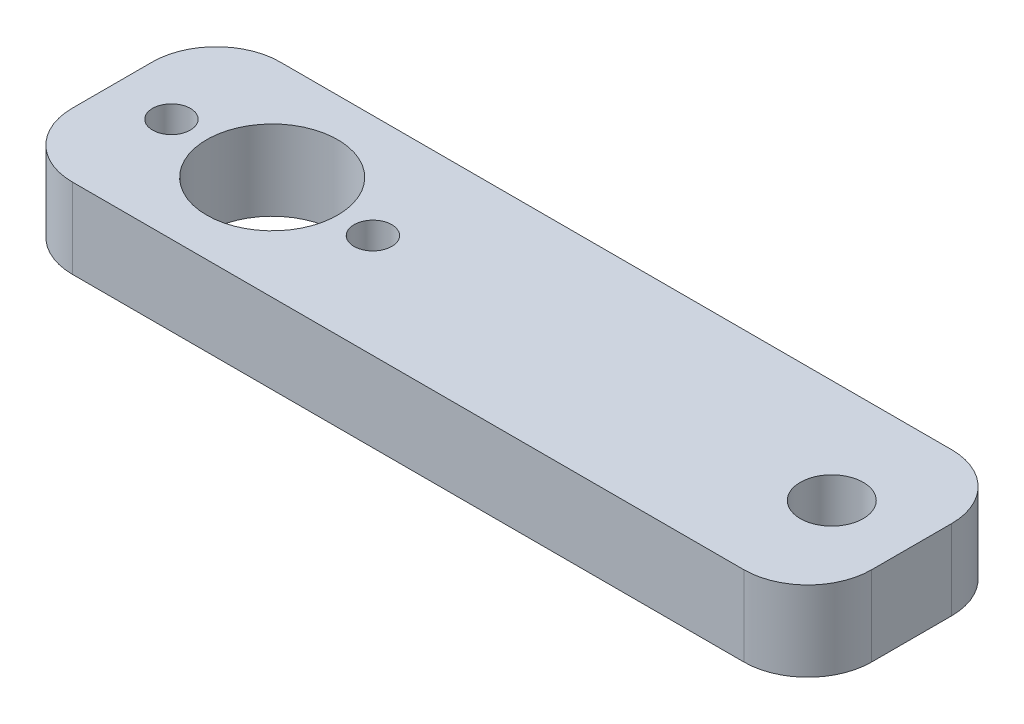
from build123d import *

# Parameters (mm, degrees)
SKETCH1_W              = 63.5
SKETCH1_H              = 16.51
BOSS_EXTRUDE1_DEPTH    = 6.35
F_5_0MM_DOWEL_HOLE1_D  = 5
F_10_0MM_DOWEL_HOLE1_D = 10.4
F_3_0MM_DOWEL_HOLE1_D  = 3
FILLET1_R              = 5.08


with BuildPart() as part:
    # Sketch1 → Boss-Extrude1 (new body)
    with BuildSketch(Plane(origin=(0, 0, 0), x_dir=(1, 0, 0), z_dir=(0, 1, 0))):
        with Locations((31.75, 8.255)):
            Rectangle(SKETCH1_W, SKETCH1_H)
    extrude(amount=BOSS_EXTRUDE1_DEPTH)

    # Ø5.0mm Dowel Hole1 (through all)
    with Locations(Plane(origin=(0, 6.35, 0), x_dir=(1, 0, 0), z_dir=(0, 1, 0))):
        with Locations((57.15, 8.255)):
            Hole(F_5_0MM_DOWEL_HOLE1_D / 2)

    # Ø10.0mm Dowel Hole1 (through all)
    with Locations(Plane(origin=(12.7, 6.35, -8.255), x_dir=(0, 0, 1), z_dir=(0, 1, 0))):
        with Locations((0, 0)):
            Hole(F_10_0MM_DOWEL_HOLE1_D / 2)

    # Ø3.0mm Dowel Hole1 (through all)
    with Locations(Plane(origin=(0, 6.35, 0), x_dir=(1, 0, 0), z_dir=(0, 1, 0))):
        with Locations((4.699, 8.255), (20.701, 8.255)):
            Hole(F_3_0MM_DOWEL_HOLE1_D / 2)

    # Fillet1
    fillet1_edges = [part.edges().sort_by_distance(p)[0] for p in [
        (63.5, 3.175, -16.51),
        (63.5, 3.175, 0),
        (0, 3.175, 0),
        (0, 3.175, -16.51),
    ]]
    fillet(fillet1_edges, radius=FILLET1_R)


solid = part.part
